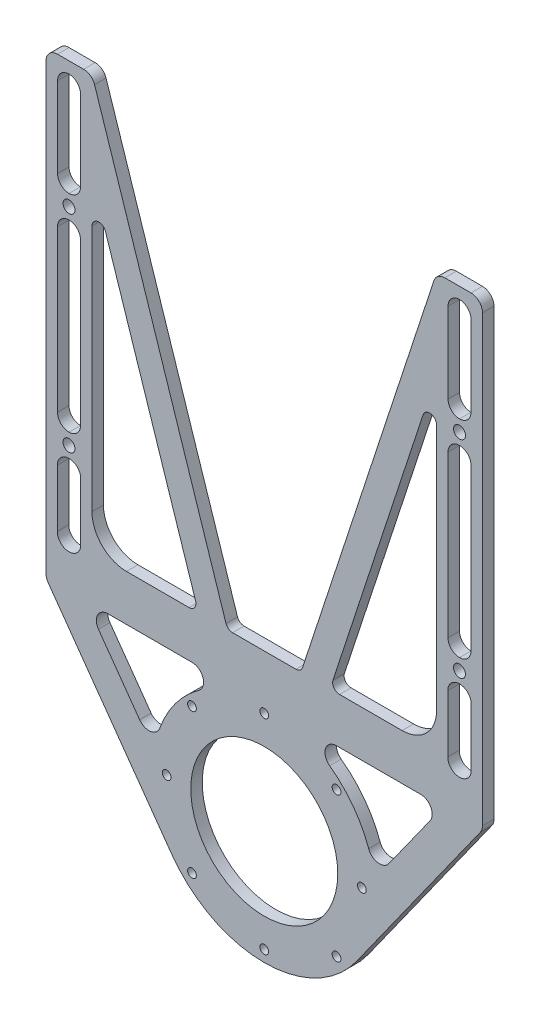
from build123d import *

# Parameters (mm, degrees)
SKETCH_1_W          = 20
SKETCH_1_H          = 200
SKETCH_1_R          = 28.5
EXTRUDE_1_DEPTH     = 2.5
CUT_EXTRUDE_2_DEPTH = 10
EXTRUDE_2_DEPTH     = 5
SKETCH_4_R          = 2.6
CUT_EXTRUDE_3_DEPTH = 10
SKETCH_5_W          = 150
SKETCH_5_H          = 20
EXTRUDE_3_DEPTH     = 5
FILLET_1_R          = 15
CUT_EXTRUDE_START   = -10
SKETCH_6_W          = 10
SKETCH_6_H          = 45
SKETCH_6_H_2        = 80
SKETCH_6_R          = 32
SKETCH_6_R_2        = 28.5
CUT_EXTRUDE_4_DEPTH = 10
CUT_EXTRUDE_5_DEPTH = 10
SKETCH_8_R          = 1.9
CUT_EXTRUDE_6_DEPTH = 10
EXTRUDE_4_DEPTH     = 5
FILLET_3_R          = 3
CUT_EXTRUDE_9_DEPTH = 14
FILLET_4_R          = 5
FILLET_5_R          = 5


with BuildPart() as part:
    # 草图1 → 凸台-拉伸1 (new, symmetric)
    # profile 1 of 3: a face of its own
    with BuildSketch(Plane.XY):
        with Locations((-85, 100)):
            Rectangle(SKETCH_1_W, SKETCH_1_H)
    # profile 2 of 3: a face of its own
    with BuildSketch(Plane.XY):
        Polygon((-75, 0), (-95, 0), (-95, -83), (95, -83), (95, 0), (75, 0), align=None)
        with Locations((0, -48)):
            Circle(SKETCH_1_R, mode=Mode.SUBTRACT)
    # profile 3 of 3: a face of its own
    with BuildSketch(Plane.XY):
        with Locations((85, 100)):
            Rectangle(SKETCH_1_W, SKETCH_1_H)
    extrude(amount=EXTRUDE_1_DEPTH, both=True)

    # 草图2 → 切除-拉伸2 (cut)
    with BuildSketch(Plane.XY.offset(2.5)):
        with BuildLine():
            Line((-25.660561099, -72.531318841), (-95, 0))
            Line((-95, 0), (-95, -83))
            Line((-95, -83), (-5.937171044, -83))
            ThreePointArc((-5.937171044, -83), (-16.643391795, -79.356777729), (-25.660561099, -72.531318841))
        make_face()
        with BuildLine():
            Line((95, 0), (25.660561099, -72.531318841))
            ThreePointArc((25.660561099, -72.531318841), (16.643391795, -79.356777729), (5.937171044, -83))
            Line((5.937171044, -83), (95, -83))
            Line((95, -83), (95, 0))
        make_face()
    extrude(amount=-CUT_EXTRUDE_2_DEPTH, mode=Mode.SUBTRACT)

    # 草图3 → 凸台-拉伸2 (add)
    with BuildSketch(Plane.XY.offset(2.5)):
        with BuildLine():
            Line((-95, 0), (-40.308710858, -76.730781907))
            ThreePointArc((-40.308710858, -76.730781907), (0, -97.5), (40.308710858, -76.730781907))
            Line((40.308710858, -76.730781907), (95, 0))
            Line((95, 0), (25.660561099, -72.531318841))
            ThreePointArc((25.660561099, -72.531318841), (16.643391795, -79.356777729), (5.937171044, -83))
            Line((5.937171044, -83), (-5.937171044, -83))
            ThreePointArc((-5.937171044, -83), (-16.643391795, -79.356777729), (-25.660561099, -72.531318841))
            Line((-25.660561099, -72.531318841), (-95, 0))
        make_face()
        with BuildLine():
            ThreePointArc((12.093386622, 0), (0, 1.5), (-12.093386622, 0))
            Line((-12.093386622, 0), (12.093386622, 0))
        make_face()
    extrude(amount=-EXTRUDE_2_DEPTH)

    # 草图4 → 切除-拉伸3 (cut)
    with BuildSketch(Plane.XY.offset(2.5)):
        with Locations((85, 145)):
            Circle(SKETCH_4_R)
        with Locations((85, 55)):
            Circle(SKETCH_4_R)
    cut_extrude_3 = extrude(amount=-CUT_EXTRUDE_3_DEPTH, mode=Mode.SUBTRACT)

    # 镜向1: 切除-拉伸3 across plane
    add(cut_extrude_3.mirror(Plane(origin=(0, 0, 0), x_dir=(0, 0, 1), z_dir=(1, 0, 0))), mode=Mode.SUBTRACT)

    # 草图5 → 凸台-拉伸3 (add)
    with BuildSketch(Plane.XY.offset(2.5)):
        with Locations((0, 10)):
            Rectangle(SKETCH_5_W, SKETCH_5_H)
    extrude(amount=-EXTRUDE_3_DEPTH)

    # 圆角1
    fillet_1_edges = [part.edges().sort_by_distance(p)[0] for p in [
        (-75, 20, 0),
        (75, 20, 0),
    ]]
    fillet(fillet_1_edges, radius=FILLET_1_R)

    # 草图6 → 切除-拉伸4 (cut)
    # profile 1 of 5: a face of its own
    with BuildSketch(Plane.XY.offset(2.5).offset(CUT_EXTRUDE_START)):
        with Locations((-85, 172.5)):
            Rectangle(SKETCH_6_W, SKETCH_6_H)
    # profile 2 of 5: a face of its own
    with BuildSketch(Plane.XY.offset(2.5).offset(CUT_EXTRUDE_START)):
        with Locations((-85, 100)):
            Rectangle(SKETCH_6_W, SKETCH_6_H_2)
    # profile 3 of 5: a face of its own
    with BuildSketch(Plane.XY.offset(2.5).offset(CUT_EXTRUDE_START)):
        with Locations((85, 100)):
            Rectangle(SKETCH_6_W, SKETCH_6_H_2)
    # profile 4 of 5: a face of its own
    with BuildSketch(Plane.XY.offset(2.5).offset(CUT_EXTRUDE_START)):
        with Locations((85, 172.5)):
            Rectangle(SKETCH_6_W, SKETCH_6_H)
    # profile 5 of 5: a face of its own
    with BuildSketch(Plane.XY.offset(2.5).offset(CUT_EXTRUDE_START)):
        with Locations((0, -48)):
            Circle(SKETCH_6_R)
        with Locations((0, -48)):
            Circle(SKETCH_6_R_2, mode=Mode.SUBTRACT)
    extrude(amount=CUT_EXTRUDE_4_DEPTH, mode=Mode.SUBTRACT)

    # 草图7 → 切除-拉伸5 (cut)
    with BuildSketch(Plane.XY.offset(2.5)):
        with BuildLine():
            Line((-79.89229429, 45), (-79.89229429, 20))
            ThreePointArc((-79.89229429, 20), (-85, 14.89229429), (-90.10770571, 20))
            Line((-90.10770571, 20), (-90.10770571, 45))
            ThreePointArc((-90.10770571, 45), (-85, 50.10770571), (-79.89229429, 45))
        make_face()
        with BuildLine():
            Line((90.10770571, 45), (90.10770571, 20))
            ThreePointArc((90.10770571, 20), (85, 14.89229429), (79.89229429, 20))
            Line((79.89229429, 20), (79.89229429, 45))
            ThreePointArc((79.89229429, 45), (85, 50.10770571), (90.10770571, 45))
        make_face()
    extrude(amount=-CUT_EXTRUDE_5_DEPTH, mode=Mode.SUBTRACT)

    # 草图8 → 切除-拉伸6 (cut)
    with BuildSketch(Plane.XY.offset(2.5)):
        with Locations((0, -3.5)):
            Circle(SKETCH_8_R)
        with Locations((31.466251763, -16.533748237)):
            Circle(SKETCH_8_R)
        with Locations((31.466251763, -79.466251763)):
            Circle(SKETCH_8_R)
        with Locations((0, -92.5)):
            Circle(SKETCH_8_R)
        with Locations((-31.466251763, -79.466251763)):
            Circle(SKETCH_8_R)
        with Locations((-31.466251763, -16.533748237)):
            Circle(SKETCH_8_R)
        with Locations((-42.5, -48)):
            Circle(SKETCH_8_R)
        with Locations((42.5, -48)):
            Circle(SKETCH_8_R)
    extrude(amount=-CUT_EXTRUDE_6_DEPTH, mode=Mode.SUBTRACT)

    # 草图9 → 凸台-拉伸4 (add)
    with BuildSketch(Plane.XY.offset(2.5)):
        Polygon((-15.981567349, 20), (-75, 200), (-75, 161.484192434), (-28.61013732, 20), align=None)
    extrude_4 = extrude(amount=-EXTRUDE_4_DEPTH)

    # 镜向2: 凸台-拉伸4 across plane
    add(extrude_4.mirror(Plane(origin=(0, 0, 0), x_dir=(0, 0, 1), z_dir=(1, 0, 0))))

    # 圆角3
    fillet_3_edges = [part.edges().sort_by_distance(p)[0] for p in [
        (-75, 161.484192434, 0),
        (-15.981567349, 20, 0),
        (-28.61013732, 20, 0),
        (75, 161.484192434, 0),
        (28.61013732, 20, 0),
        (15.981567349, 20, 0),
    ]]
    fillet(fillet_3_edges, radius=FILLET_3_R)

    # 草图11 → 切除-拉伸9 (cut)
    with BuildSketch(Plane.XY.offset(2.5)):
        with BuildLine():
            Line((-77.807686347, 0), (-47.883202974, -41.983450078))
            ThreePointArc((-47.883202974, -41.983450078), (-33.761084244, -13.515377475), (-5, 0))
            Line((-5, 0), (-77.807686347, 0))
        make_face()
        with BuildLine():
            Line((77.807686347, 0), (5, 0))
            ThreePointArc((5, 0), (33.761084244, -13.515377475), (47.883202974, -41.983450078))
            Line((47.883202974, -41.983450078), (77.807686347, 0))
        make_face()
    extrude(amount=-CUT_EXTRUDE_9_DEPTH, mode=Mode.SUBTRACT)

    # 圆角4
    fillet_4_edges = [part.edges().sort_by_distance(p)[0] for p in [
        (-47.883202974, -41.983450078, 0),
        (-5, 0, 0),
        (-80, 60, 0),
        (-90, 60, 0),
        (-90, 140, 0),
        (-80, 140, 0),
        (80, 150, 0),
        (80, 195, 0),
        (90, 195, 0),
        (90, 150, 0),
        (-90, 195, 0),
        (-80, 195, 0),
        (-80, 150, 0),
        (-90, 150, 0),
        (90, 60, 0),
        (80, 60, 0),
        (80, 140, 0),
        (90, 140, 0),
        (5, 0, 0),
        (77.807686347, 0, 0),
        (47.883202974, -41.983450078, 0),
        (-77.807686347, 0, 0),
    ]]
    fillet(fillet_4_edges, radius=FILLET_4_R - 0.0001)  # a hair under: the kernel refuses the full size

    # 圆角5
    fillet_5_edges = [part.edges().sort_by_distance(p)[0] for p in [
        (-95, 200, 0),
        (-75, 200, 0),
        (75, 200, 0),
        (95, 200, 0),
        (-95, 0, 0),
        (95, 0, 0),
    ]]
    fillet(fillet_5_edges, radius=FILLET_5_R)


solid = part.part
